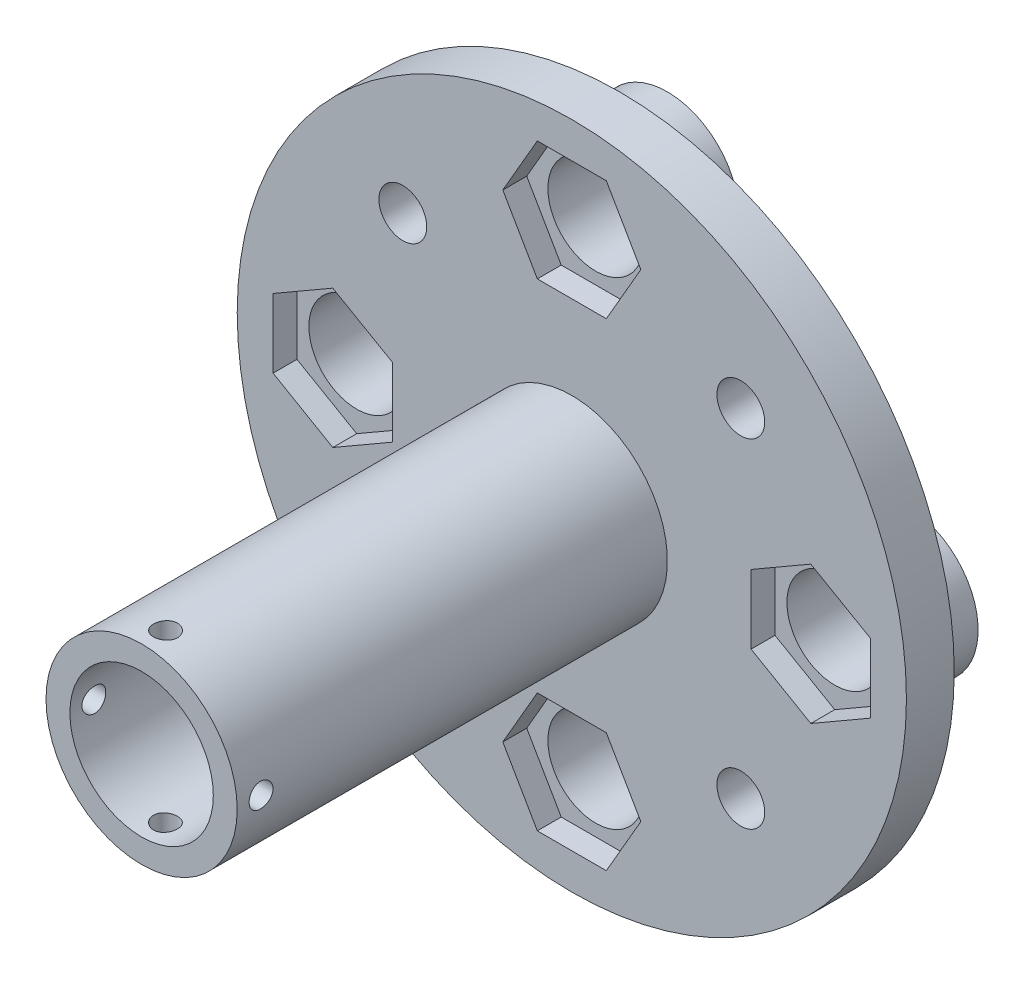
from build123d import *
from build123d.topology import SkipClean

# Parameters (mm, degrees)
SKETCH1_R               = 20
SKETCH1_R_2             = 15
EXTRUDE1_DEPTH          = 90
EXTRUDE2_START          = 10
SKETCH2_R               = 70
SKETCH2_R_2             = 15
EXTRUDE2_DEPTH          = 10
SKETCH3_R               = 10
CUT_EXTRUDE1_DEPTH      = 141.712472795
CUT_EXTRUDE2_DEPTH      = 5
CUT_EXTRUDE3_DEPTH      = 134.790881603
CUT_EXTRUDE3_DEPTH_BACK = 134.790881603
SKETCH6_R               = 2.5
CUT_EXTRUDE4_DEPTH      = 134.79088167
CUT_EXTRUDE4_DEPTH_BACK = 134.79088167
SKETCH7_R               = 2.5
SKETCH8_R               = 5
CUT_EXTRUDE5_DEPTH      = 134.79088167
EXTRUDE3_START          = 10
SKETCH9_R               = 15
SKETCH9_R_2             = 10
EXTRUDE3_DEPTH          = 10
EXTRUDE5_DEPTH          = 10
EXTRUDE5_DEPTH_BACK     = 10
SKETCH11_R              = 15


with BuildPart() as part:
    # Sketch1 → Extrude1 (new body)
    with BuildSketch(Plane.XY):
        Circle(SKETCH1_R)
        Circle(SKETCH1_R_2, mode=Mode.SUBTRACT)
    extrude(amount=EXTRUDE1_DEPTH)

    # Sketch2 → Extrude2 (add)
    with SkipClean():  # the faces are left unmerged after this step: merging them gives an invalid solid
        with BuildSketch(Plane(origin=(0, 0, 0), x_dir=(-1, 0, 0), z_dir=(0, 0, -1)).offset(EXTRUDE2_START)):
            Circle(SKETCH2_R)
            Circle(SKETCH2_R_2, mode=Mode.SUBTRACT)
        extrude(amount=-EXTRUDE2_DEPTH)

    # Sketch3 → Cut-Extrude1 (cut, through all)
    with SkipClean():  # the faces are left unmerged after this step: merging them gives an invalid solid
        with BuildSketch(Plane(origin=(0, 0, -10), x_dir=(-1, 0, 0), z_dir=(0, 0, -1))):
            with Locations((0, 50)):
                Circle(SKETCH3_R)
            with Locations((50, 0)):
                Circle(SKETCH3_R)
            with Locations((0, -50)):
                Circle(SKETCH3_R)
            with Locations((-50, 0)):
                Circle(SKETCH3_R)
        extrude(amount=-CUT_EXTRUDE1_DEPTH, mode=Mode.SUBTRACT)

    # Sketch4 → Cut-Extrude2 (cut)
    with SkipClean():  # the faces are left unmerged after this step: merging them gives an invalid solid
        with BuildSketch(Plane.XY):
            Polygon((50, -14.43375673), (62.5, -7.216878365), (62.5, 7.216878365), (50, 14.43375673), (37.5, 7.216878365), (37.5, -7.216878365), align=None)
            Polygon((14.43375673, 50), (7.216878365, 62.5), (-7.216878365, 62.5), (-14.43375673, 50), (-7.216878365, 37.5), (7.216878365, 37.5), align=None)
            Polygon((-14.43375673, -50), (-7.216878365, -62.5), (7.216878365, -62.5), (14.43375673, -50), (7.216878365, -37.5), (-7.216878365, -37.5), align=None)
            Polygon((-50, 14.43375673), (-62.5, 7.216878365), (-62.5, -7.216878365), (-50, -14.43375673), (-37.5, -7.216878365), (-37.5, 7.216878365), align=None)
        extrude(amount=-CUT_EXTRUDE2_DEPTH, mode=Mode.SUBTRACT)

    # Sketch6 → Cut-Extrude3 (cut, two sides: drawn at the far end of the back side and taken through both)
    with SkipClean():  # the faces are left unmerged after this step: merging them gives an invalid solid
        with BuildSketch(Plane(origin=(0, 0, 0), x_dir=(0, 0, -1), z_dir=(1, 0, 0)).offset(-CUT_EXTRUDE3_DEPTH_BACK)):
            with Locations((-85, 0)):
                Circle(SKETCH6_R)
        extrude(amount=CUT_EXTRUDE3_DEPTH + CUT_EXTRUDE3_DEPTH_BACK, mode=Mode.SUBTRACT)

    # Sketch7 → Cut-Extrude4 (cut, two sides: drawn at the far end of the back side and taken through both)
    with SkipClean():  # the faces are left unmerged after this step: merging them gives an invalid solid
        with BuildSketch(Plane(origin=(0, 0, 0), x_dir=(1, 0, 0), z_dir=(0, 1, 0)).offset(-CUT_EXTRUDE4_DEPTH_BACK)):
            with Locations((0, -85)):
                Circle(SKETCH7_R)
        extrude(amount=CUT_EXTRUDE4_DEPTH + CUT_EXTRUDE4_DEPTH_BACK, mode=Mode.SUBTRACT)

    # Sketch8 → Cut-Extrude5 (cut, through all)
    with SkipClean():  # the faces are left unmerged after this step: merging them gives an invalid solid
        with BuildSketch(Plane.XY):
            with Locations((35.355339059, 35.355339059)):
                Circle(SKETCH8_R)
            with Locations((35.355339059, -35.355339059)):
                Circle(SKETCH8_R)
            with Locations((-35.355339059, -35.355339059)):
                Circle(SKETCH8_R)
            with Locations((-35.355339059, 35.355339059)):
                Circle(SKETCH8_R)
        extrude(amount=-CUT_EXTRUDE5_DEPTH, mode=Mode.SUBTRACT)

    # Sketch9 → Extrude3 (add)
    # profile 1 of 4: a face of its own
    with SkipClean():  # the faces are left unmerged after this step: merging them gives an invalid solid
        with BuildSketch(Plane(origin=(0, 0, -10), x_dir=(-1, 0, 0), z_dir=(0, 0, -1)).offset(EXTRUDE3_START)):
            with Locations((0, 50)):
                Circle(SKETCH9_R)
            with Locations((0, 50)):
                Circle(SKETCH9_R_2, mode=Mode.SUBTRACT)
        # profile 2 of 4: a face of its own
        with BuildSketch(Plane(origin=(0, 0, -10), x_dir=(-1, 0, 0), z_dir=(0, 0, -1)).offset(EXTRUDE3_START)):
            with Locations((50, 0)):
                Circle(SKETCH9_R)
            with Locations((50, 0)):
                Circle(SKETCH9_R_2, mode=Mode.SUBTRACT)
        # profile 3 of 4: a face of its own
        with BuildSketch(Plane(origin=(0, 0, -10), x_dir=(-1, 0, 0), z_dir=(0, 0, -1)).offset(EXTRUDE3_START)):
            with Locations((0, -50)):
                Circle(SKETCH9_R)
            with Locations((0, -50)):
                Circle(SKETCH9_R_2, mode=Mode.SUBTRACT)
        # profile 4 of 4: a face of its own
        with BuildSketch(Plane(origin=(0, 0, -10), x_dir=(-1, 0, 0), z_dir=(0, 0, -1)).offset(EXTRUDE3_START)):
            with Locations((-50, 0)):
                Circle(SKETCH9_R)
            with Locations((-50, 0)):
                Circle(SKETCH9_R_2, mode=Mode.SUBTRACT)
        extrude(amount=-EXTRUDE3_DEPTH)

    # Sketch11 → Extrude5 (add, two sides: drawn at the far end of the back side and taken through both)
    with BuildSketch(Plane(origin=(0, 0, -10), x_dir=(-1, 0, 0), z_dir=(0, 0, -1)).offset(-EXTRUDE5_DEPTH_BACK)):
        Circle(SKETCH11_R)
        Polygon((11.547005384, 0), (5.773502692, 10), (-5.773502692, 10), (-11.547005384, 0), (-5.773502692, -10), (5.773502692, -10), align=None, mode=Mode.SUBTRACT)
    extrude(amount=EXTRUDE5_DEPTH + EXTRUDE5_DEPTH_BACK)


solid = part.part
